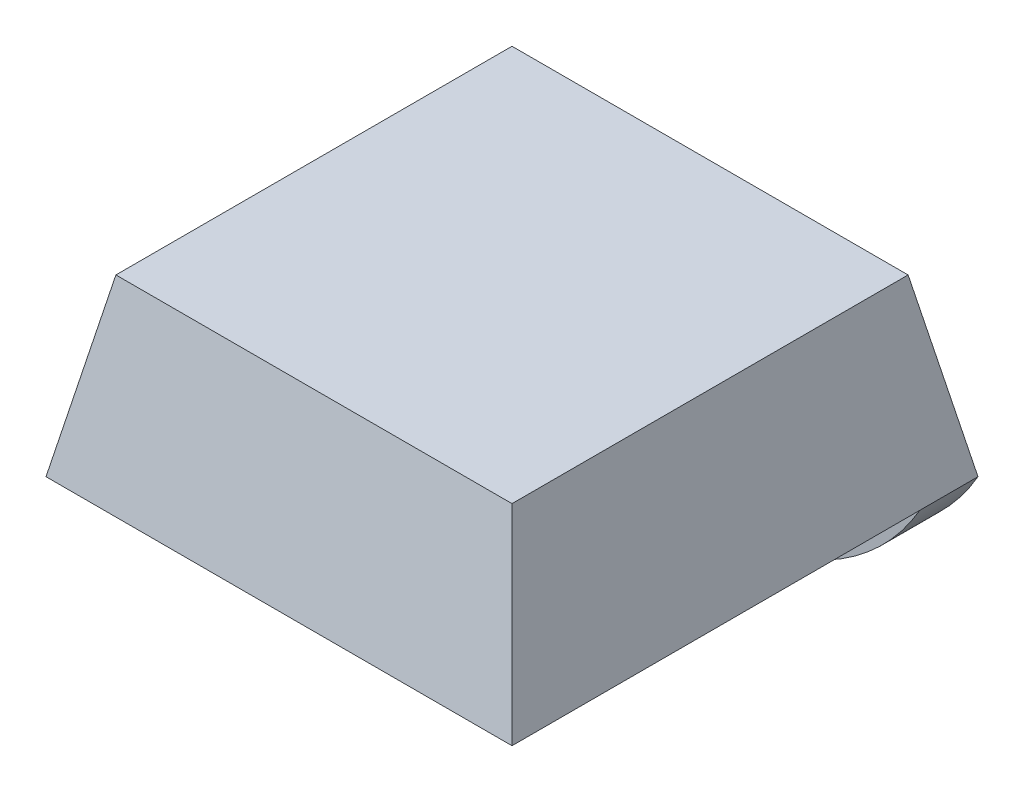
from build123d import *

# Parameters (mm, degrees)
SKETCH1_W               = 8
SKETCH1_H               = 8
BOSS_EXTRUDE1_DEPTH     = 3
CUT_EXTRUDE1_DEPTH      = 12.704699911
CUT_EXTRUDE1_DEPTH_BACK = 12.704699911
CUT_EXTRUDE2_DEPTH      = 11
SKETCH4_R               = 1.8
CUT_EXTRUDE3_DEPTH      = 0.8
SKETCH5_W               = 8
SKETCH5_H               = 1
BOSS_EXTRUDE2_DEPTH     = 2
FILLET1_R               = 4


with BuildPart() as part:
    # Sketch1 → Boss-Extrude1 (new body)
    with BuildSketch(Plane(origin=(0, 0, 0), x_dir=(1, 0, 0), z_dir=(0, 1, 0))):
        with Locations((4, 4)):
            Rectangle(SKETCH1_W, SKETCH1_H)
    extrude(amount=BOSS_EXTRUDE1_DEPTH)

    # Sketch2 → Cut-Extrude1 (cut, two sides: drawn at the far end of the back side and taken through both)
    with BuildSketch(Plane.XY.offset(-CUT_EXTRUDE1_DEPTH_BACK)):
        Polygon((0, 0), (0.6, 3), (0, 3), align=None)
        Polygon((8, 0), (7.4, 3), (8, 3), align=None)
    extrude(amount=CUT_EXTRUDE1_DEPTH + CUT_EXTRUDE1_DEPTH_BACK, mode=Mode.SUBTRACT)

    # Sketch3 → Cut-Extrude2 (cut)
    with BuildSketch(Plane(origin=(0, 0, 0), x_dir=(0, 0, -1), z_dir=(1, 0, 0))):
        Polygon((0, 0), (0.6, 3), (0, 3), align=None)
        Polygon((8, 3), (7.4, 3), (8, 0), align=None)
    extrude(amount=CUT_EXTRUDE2_DEPTH, mode=Mode.SUBTRACT)

    # Sketch4 → Cut-Extrude3 (cut)
    with BuildSketch(Plane.XZ):
        with Locations(Location((4, -3.75, 0), (0, 0, 270))):
            Circle(SKETCH4_R)
    extrude(amount=-CUT_EXTRUDE3_DEPTH, mode=Mode.SUBTRACT)

    # Sketch5 → Boss-Extrude2 (add)
    with BuildSketch(Plane.XZ):
        with Locations((4, -7.5)):
            Rectangle(SKETCH5_W, SKETCH5_H)
    extrude(amount=BOSS_EXTRUDE2_DEPTH)

    # Fillet1
    # the kernel refuses this fillet: 4 mm, written as the material it takes off along each edge
    with BuildSketch(Plane(origin=(8, -2, -16.660254038), x_dir=(0, 1, 0), z_dir=(0, 0, 1)), Plane(origin=(0, -2, 1.660254038), x_dir=(0, 1, 0), z_dir=(0, 0, -1))) as fillet1_piece_1:
        with BuildLine():
            CenterArc((4, 3.464101615), FILLET1_R, 180, 60)
            Line((0, 3.464101615), (-0.08, 3.464101615))
            Line((-0.08, 3.464101615), (-0.08, 0))
            Line((-0.08, 0), (0, -0.08))
            ThreePointArc((0, -0.08), (1, -0.08), (1.96, -0.069282032))
            Line((1.96, -0.069282032), (2, 0))
        make_face()
    extrude(amount=18.320508076, mode=Mode.SUBTRACT)


solid = part.part
